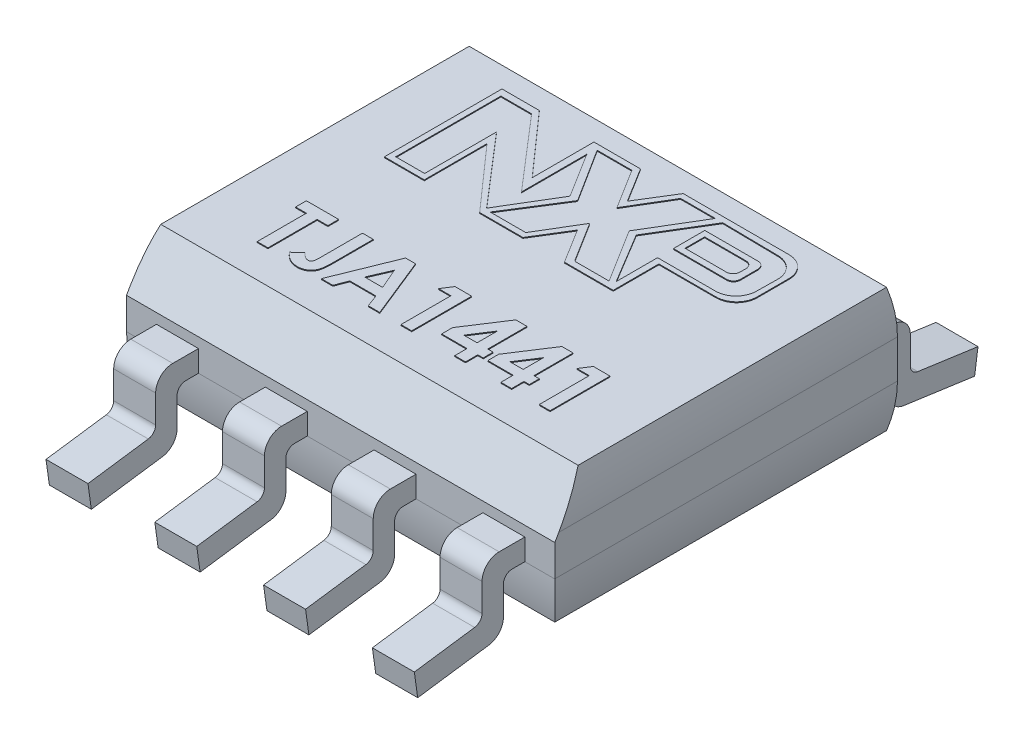
from build123d import *
from OCP.BRepAlgoAPI import BRepAlgoAPI_Cut
from OCP.TopTools import TopTools_ListOfShape

# Parameters (mm, degrees)
SKETCH1_W           = 5
SKETCH1_H           = 4
BOSS_EXTRUDE1_DEPTH = 1.45
CUT_EXTRUDE1_DEPTH  = 61.45
CUT_EXTRUDE2_DEPTH  = 61.45
BOSS_EXTRUDE2_DEPTH = 5
SKETCH7_W           = 0.35
SKETCH7_H           = 1.533953372
SKETCH7_W_2         = 0.78
SKETCH7_H_2         = 1.610570248
SKETCH7_H_3         = 1.782958217
SKETCH7_H_4         = 1.677610014
CUT_EXTRUDE3_DEPTH  = 61.45
BOSS_EXTRUDE3_DEPTH = 0.01
BOSS_EXTRUDE4_DEPTH = 0.01


with BuildPart() as part:
    # Sketch1 → Boss-Extrude1 (new body)
    with BuildSketch(Plane(origin=(0, 0, 0), x_dir=(1, 0, 0), z_dir=(0, 1, 0))):
        Rectangle(SKETCH1_W, SKETCH1_H)
    extrude(amount=BOSS_EXTRUDE1_DEPTH)

    # Sketch2 → Cut-Extrude1 (cut)
    with BuildSketch(Plane.ZY.offset(2.5)):
        Polygon((2, 0.86865368), (1.664359546, 1.45), (1.664359546, 1.731681291), (2.487143748, 1.731681291), (2.487143748, 0.86865368), align=None)
        with BuildLine():
            Line((-1.864420937, 1.672264495), (-2.155873567, 1.672264495))
            Line((-2.155873567, 1.672264495), (-2.155873567, 0.954004167))
            Line((-2.155873567, 0.954004167), (-1.999984404, 0.948389144))
            ThreePointArc((-1.999984404, 0.948389144), (-1.965805293, 1.316619369), (-1.864420937, 1.672264495))
        make_face()
        with BuildLine():
            Line((-1.999984404, 0.501610856), (-2.15587357, 0.501610856))
            Line((-2.15587357, 0.501610856), (-2.15587357, -0.22229559))
            Line((-2.15587357, -0.22229559), (-1.864420937, -0.222264495))
            ThreePointArc((-1.864420937, -0.222264495), (-1.965805293, 0.133380631), (-1.999984404, 0.501610856))
        make_face()
        with BuildLine():
            Line((2, 0.501548667), (2.487143748, 0.501548667))
            Line((2.487143748, 0.501548667), (2.487143748, -0.222291374))
            Line((2.487143748, -0.222291374), (1.864414025, -0.222322469))
            ThreePointArc((1.864414025, -0.222322469), (1.965809439, 0.133319505), (2, 0.501548667))
        make_face()
    extrude(amount=-CUT_EXTRUDE1_DEPTH, mode=Mode.SUBTRACT)


with BuildPart() as cut_extrude2_tool:
    # Sketch5 → Cut-Extrude2 (new body)
    with BuildSketch(Plane(origin=(0, 0, -2), x_dir=(-1, 0, 0), z_dir=(0, 0, -1))):
        with BuildLine():
            Line((-2.655873567, 0.954004878), (-2.499991937, 0.948390126))
            ThreePointArc((-2.499991937, 0.948390126), (-2.46581276, 1.316621068), (-2.364420937, 1.672264066))
            Line((-2.364420937, 1.672264066), (-2.655873567, 1.672264066))
            Line((-2.655873567, 1.672264066), (-2.655873567, 0.954004878))
        make_face()
        with BuildLine():
            ThreePointArc((-2.364420937, -0.222263785), (-2.46581276, 0.133379212), (-2.499991937, 0.501610155))
            Line((-2.499991937, 0.501610155), (-2.655873567, 0.495995403))
            Line((-2.65587357, 0.495995403), (-2.65587357, -0.22229488))
            Line((-2.65587357, -0.22229488), (-2.364420937, -0.222263785))
        make_face()
        with BuildLine():
            ThreePointArc((2.499991937, 0.948390126), (2.46581276, 1.316621068), (2.364420937, 1.672264066))
            Line((2.364420937, 1.672264066), (2.655873567, 1.672264066))
            Line((2.655873567, 1.672264066), (2.655873567, 0.954004878))
            Line((2.655873567, 0.954004878), (2.499991937, 0.948390126))
        make_face()
        with BuildLine():
            Line((2.499991937, 0.501610155), (2.65587357, 0.501610155))
            Line((2.65587357, 0.501610155), (2.65587357, -0.22229488))
            Line((2.65587357, -0.22229488), (2.364420937, -0.222263785))
            ThreePointArc((2.364420937, -0.222263785), (2.46581276, 0.133379212), (2.499991937, 0.501610155))
        make_face()
    extrude(amount=-CUT_EXTRUDE2_DEPTH)


with BuildPart() as part_1:
    add(part.part)

    # Cut-Extrude2: cut by cut_extrude2_tool, with a tolerance
    cut_extrude2_stock = TopTools_ListOfShape()
    cut_extrude2_stock.Append(part_1.part.wrapped)
    cut_extrude2_tools = TopTools_ListOfShape()
    cut_extrude2_tools.Append(cut_extrude2_tool.part.wrapped)
    cut_extrude2_cut = BRepAlgoAPI_Cut()
    cut_extrude2_cut.SetArguments(cut_extrude2_stock)
    cut_extrude2_cut.SetTools(cut_extrude2_tools)
    cut_extrude2_cut.SetFuzzyValue(0.00001)
    cut_extrude2_cut.Build()
    add(Compound.cast(cut_extrude2_cut.Shape()).solids(), mode=Mode.REPLACE)

    # Sketch6 → Boss-Extrude2 (add)
    with BuildSketch(Plane.ZY.offset(2.5)):
        with BuildLine():
            Line((2.300001958, 0.75), (2.253544498, 0.75))
            Line((2.253544498, 0.75), (-2.253544498, 0.75))
            Line((-2.253544498, 0.75), (-2.300001958, 0.75))
            ThreePointArc((-2.300001958, 0.75), (-2.441423314, 0.691421356), (-2.500001958, 0.55))
            Line((-2.500001958, 0.55), (-2.500001958, 0.227578594))
            ThreePointArc((-2.500001958, 0.227578594), (-2.524531, 0.161972691), (-2.586084648, 0.128551787))
            Line((-2.586084648, 0.128551787), (-3.290075098, 0.029612381))
            Line((-3.290075098, 0.029612381), (-3.250778141, -0.25))
            Line((-3.250778141, -0.25), (-2.422167338, -0.133546346))
            ThreePointArc((-2.422167338, -0.133546346), (-2.299060042, -0.066704538), (-2.250001958, 0.064507268))
            Line((-2.250001958, 0.064507268), (-2.250001958, 0.4))
            ThreePointArc((-2.250001958, 0.4), (-2.220712636, 0.470710678), (-2.150001958, 0.5))
            Line((-2.150001958, 0.5), (2.150001958, 0.5))
            ThreePointArc((2.150001958, 0.5), (2.220712636, 0.470710678), (2.250001958, 0.4))
            Line((2.250001958, 0.4), (2.250001958, 0.064507268))
            ThreePointArc((2.250001958, 0.064507268), (2.299060042, -0.066704538), (2.422167338, -0.133546346))
            Line((2.422167338, -0.133546346), (3.250778141, -0.25))
            Line((3.250778141, -0.25), (3.290075098, 0.029612381))
            Line((3.290075098, 0.029612381), (2.586084648, 0.128551787))
            ThreePointArc((2.586084648, 0.128551787), (2.524531, 0.161972691), (2.500001958, 0.227578594))
            Line((2.500001958, 0.227578594), (2.500001958, 0.55))
            ThreePointArc((2.500001958, 0.55), (2.441423314, 0.691421356), (2.300001958, 0.75))
        make_face()
    extrude(amount=-BOSS_EXTRUDE2_DEPTH)

    # Sketch7 → Cut-Extrude3 (cut)
    with BuildSketch(Plane(origin=(0, 1.45, 0), x_dir=(1, 0, 0), z_dir=(0, 1, 0))):
        with Locations((-2.325, -2.766976686)):
            Rectangle(SKETCH7_W, SKETCH7_H)
        with Locations((-1.27, -2.805285124)):
            Rectangle(SKETCH7_W_2, SKETCH7_H_2)
        with Locations((0, -2.805285124)):
            Rectangle(SKETCH7_W_2, SKETCH7_H_2)
        with Locations((2.325, -2.891479109)):
            Rectangle(SKETCH7_W, SKETCH7_H_3)
        with Locations((1.27, -2.838805007)):
            Rectangle(SKETCH7_W_2, SKETCH7_H_4)
        with Locations((1.27, 2.838805007)):
            Rectangle(SKETCH7_W_2, SKETCH7_H_4)
        with Locations((2.325, 2.891479109)):
            Rectangle(SKETCH7_W, SKETCH7_H_3)
        with Locations((0, 2.805285124)):
            Rectangle(SKETCH7_W_2, SKETCH7_H_2)
        with Locations((-1.27, 2.805285124)):
            Rectangle(SKETCH7_W_2, SKETCH7_H_2)
        with Locations((-2.325, 2.766976686)):
            Rectangle(SKETCH7_W, SKETCH7_H)
    extrude(amount=-CUT_EXTRUDE3_DEPTH, mode=Mode.SUBTRACT)

    # Sketch8 → Boss-Extrude3 (add)
    # profile 1 of 2: a face of its own
    with BuildSketch(Plane(origin=(0, 1.45, 0), x_dir=(1, 0, 0), z_dir=(0, 1, 0))):
        with BuildLine():
            Line((-1.803375496, 0.313929244), (-1.803375496, 1.686128651))
            Line((-1.803375496, 1.686128651), (-1.367177563, 1.686128651))
            Line((-1.367177563, 1.686128651), (-0.729512855, 0.965015135))
            Line((-0.729512855, 0.965015135), (-0.729512855, 1.686128651))
            Line((-0.729512855, 1.686128651), (-0.186049825, 1.686128651))
            Line((-0.186049825, 1.686128651), (0.063647762, 1.28357467))
            Line((0.063647762, 1.28357467), (0.31227987, 1.686128651))
            Line((0.31227987, 1.686128651), (1.548664193, 1.686128651))
            ThreePointArc((1.548664193, 1.686128651), (1.71836982, 1.615834278), (1.788664193, 1.446128651))
            Line((1.788664193, 1.446128651), (1.788664193, 1.073244082))
            ThreePointArc((1.788664193, 1.073244082), (1.71836982, 0.903538454), (1.548664193, 0.833244082))
            Line((1.548664193, 0.833244082), (0.881704624, 0.833244082))
            Line((0.881704624, 0.833244082), (0.881704624, 0.299873291))
            Line((0.881704624, 0.299873291), (0.31227987, 0.299873291))
            Line((0.31227987, 0.299873291), (0.063647762, 0.700709541))
            Line((0.063647762, 0.700709541), (-0.179553334, 0.306948774))
            Line((-0.179553334, 0.306948774), (-0.684190472, 0.306948774))
            Line((-0.684190472, 0.306948774), (-1.337736001, 1.046021375))
            Line((-1.337736001, 1.046021375), (-1.337736001, 0.313929244))
            Line((-1.337736001, 0.313929244), (-1.803375496, 0.313929244))
        make_face()
        Polygon((-1.737717167, 0.380080618), (-1.737717167, 1.607932124), (-1.378914568, 1.607932124), (-0.648130736, 0.758975413), (-0.648130736, 1.522116291), (-0.322062078, 0.999645994), (-0.687545107, 0.391434051), (-1.399882226, 1.218961086), (-1.399882226, 0.380080618), align=None, mode=Mode.SUBTRACT)
        Polygon((-0.627925102, 1.622168194), (-0.22215297, 1.622168194), (0.06797424, 1.157765207), (0.346386813, 1.622168194), (0.751426259, 1.622168194), (0.374330406, 0.993157662), (0.764288881, 0.368956019), (0.361905461, 0.368956019), (0.06797424, 0.839448039), (-0.211673984, 0.372983937), (-0.627925102, 0.372983937), (-0.233354138, 0.999645994), align=None, mode=Mode.SUBTRACT)
        with BuildLine():
            Line((0.838091157, 1.622168194), (1.493858319, 1.612977237))
            ThreePointArc((1.493858319, 1.612977237), (1.662562161, 1.540311479), (1.730471342, 1.369637398))
            Line((1.730471342, 1.369637398), (1.727040318, 1.124836692))
            ThreePointArc((1.727040318, 1.124836692), (1.655576174, 0.957309466), (1.487063887, 0.888200101))
            Line((1.487063887, 0.888200101), (0.811207804, 0.888200101))
            Line((0.811207804, 0.888200101), (0.811207804, 0.405870091))
            Line((0.811207804, 0.405870091), (0.45710645, 0.993157662))
            Line((0.45710645, 0.993157662), (0.838091157, 1.622168194))
        make_face(mode=Mode.SUBTRACT)
    # profile 2 of 2: a face of its own
    with BuildSketch(Plane(origin=(0, 1.45, 0), x_dir=(1, 0, 0), z_dir=(0, 1, 0))):
        with BuildLine():
            Line((0.811207804, 1.439616889), (1.43299067, 1.439616889))
            ThreePointArc((1.43299067, 1.439616889), (1.489559213, 1.416185432), (1.51299067, 1.359616889))
            Line((1.51299067, 1.359616889), (1.51299067, 1.153244082))
            ThreePointArc((1.51299067, 1.153244082), (1.489559213, 1.096675539), (1.43299067, 1.073244082))
            Line((1.43299067, 1.073244082), (0.811207804, 1.073244082))
            Line((0.811207804, 1.073244082), (0.811207804, 1.439616889))
        make_face()
        with BuildLine():
            Line((0.875476734, 1.373219945), (1.358258838, 1.373219945))
            ThreePointArc((1.358258838, 1.373219945), (1.41482738, 1.349788487), (1.438258838, 1.293219945))
            Line((1.438258838, 1.293219945), (1.438258838, 1.223991427))
            ThreePointArc((1.438258838, 1.223991427), (1.41482738, 1.167422884), (1.358258838, 1.143991427))
            Line((1.358258838, 1.143991427), (0.875476734, 1.143991427))
            Line((0.875476734, 1.143991427), (0.875476734, 1.373219945))
        make_face(mode=Mode.SUBTRACT)
    extrude(amount=BOSS_EXTRUDE3_DEPTH)

    # Sketch9 → Boss-Extrude4 (add)
    # profile 1 of 7: a face of its own
    with BuildSketch(Plane(origin=(0, 1.45, 0), x_dir=(1, 0, 0), z_dir=(0, 1, 0))):
        Polygon((-1.81434085, -0.586083303), (-1.437417773, -0.586083303), (-1.437417773, -0.711724328), (-1.563058799, -0.711724328), (-1.563058799, -1.286083303), (-1.688699825, -1.286083303), (-1.688699825, -0.711724328), (-1.81434085, -0.711724328), align=None)
    # profile 2 of 7: a face of its own
    with BuildSketch(Plane(origin=(0, 1.45, 0), x_dir=(1, 0, 0), z_dir=(0, 1, 0))):
        with BuildLine():
            Line((-1.159212645, -0.586083303), (-1.03357162, -0.586083303))
            Line((-1.03357162, -0.586083303), (-1.03357162, -1.050786828))
            add(Edge.make_bspline(
                [(-1.03357162, -1.050786828), (-1.033617683, -1.059668569), (-1.033706439, -1.076781931), (-1.034595042, -1.101418854), (-1.03579659, -1.124007236), (-1.037526935, -1.144510882), (-1.040096971, -1.162928802), (-1.043005471, -1.179306946), (-1.046214354, -1.19371205), (-1.051634945, -1.209833603), (-1.060050255, -1.227686389), (-1.072749198, -1.246969934), (-1.088563447, -1.26372405), (-1.106776238, -1.278276935), (-1.127541028, -1.289800068), (-1.150379444, -1.298129019), (-1.175218477, -1.303104792), (-1.192422632, -1.30371689), (-1.201279953, -1.304032021)],
                knots=[0, 0, 0, 0, 1.22248561, 2.355488409, 3.392943897, 4.335991845, 5.186735882, 5.951517034, 6.625683685, 7.215700098, 8.28923535, 9.333114649, 10.380102123, 11.447198135, 12.530158036, 13.633358744, 14.781567393, 16, 16, 16, 16], degree=3))
            add(Edge.make_bspline(
                [(-1.201279953, -1.304032021), (-1.210508476, -1.303746316), (-1.228710727, -1.303182795), (-1.255406203, -1.298383046), (-1.281063892, -1.290687603), (-1.305551055, -1.279560916), (-1.329203174, -1.265623237), (-1.351590985, -1.248334903), (-1.373181914, -1.228232102), (-1.385981148, -1.212805716), (-1.392545979, -1.204893399)],
                knots=[0, 0, 0, 0, 0.990984786, 1.954608977, 2.90473533, 3.862451285, 4.837525908, 5.848096122, 6.896271184, 8, 8, 8, 8], degree=3))
            Line((-1.392545979, -1.204893399), (-1.297473863, -1.116972726))
            add(Edge.make_bspline(
                [(-1.297473863, -1.116972726), (-1.292495995, -1.122601289), (-1.283181064, -1.133133845), (-1.269143738, -1.146868557), (-1.256481314, -1.157902812), (-1.24454484, -1.16586192), (-1.233280675, -1.171472202), (-1.222446464, -1.175513446), (-1.211704488, -1.17780102), (-1.204608011, -1.178197313), (-1.201139729, -1.178390995)],
                knots=[0, 0, 0, 0, 1.529509877, 2.862124173, 3.996688592, 4.944357383, 5.774364335, 6.554177287, 7.293378699, 8, 8, 8, 8], degree=3))
            add(Edge.make_bspline(
                [(-1.201139729, -1.178390995), (-1.197782817, -1.178215937), (-1.19132858, -1.177879359), (-1.182453757, -1.174137867), (-1.174971709, -1.168263568), (-1.170045971, -1.161510298), (-1.166906972, -1.154606639), (-1.164945666, -1.14793319), (-1.163084384, -1.139933535), (-1.161593166, -1.130611681), (-1.160466399, -1.119846038), (-1.159904787, -1.1077673), (-1.159221795, -1.094310196), (-1.159215804, -1.084909241), (-1.159212645, -1.079953495)],
                knots=[0, 0, 0, 0, 1.003927327, 1.930222208, 2.840933547, 3.835773585, 4.407906147, 5.114514582, 5.922289074, 6.876303333, 7.950072246, 9.174518422, 10.510537432, 12, 12, 12, 12], degree=3))
            Line((-1.159212645, -1.079953495), (-1.159212645, -0.586083303))
        make_face()
    # profile 3 of 7: a face of its own
    with BuildSketch(Plane(origin=(0, 1.45, 0), x_dir=(1, 0, 0), z_dir=(0, 1, 0))):
        Polygon((-0.656508318, -0.586083303), (-0.539981876, -0.586083303), (-0.257289568, -1.286083303), (-0.39148428, -1.286083303), (-0.445891331, -1.142493559), (-0.750879312, -1.142493559), (-0.805286363, -1.286083303), (-0.93934085, -1.286083303), align=None)
        Polygon((-0.598315209, -0.773843719), (-0.70320303, -1.016852533), (-0.493427389, -1.016852533), align=None, mode=Mode.SUBTRACT)
    # profile 4 of 7: a face of its own
    with BuildSketch(Plane(origin=(0, 1.45, 0), x_dir=(1, 0, 0), z_dir=(0, 1, 0))):
        Polygon((-0.079064408, -0.586083303), (0.115146329, -0.586083303), (0.115146329, -1.286083303), (-0.010494697, -1.286083303), (-0.010494697, -0.702749969), (-0.15408444, -0.702749969), align=None)
    # profile 5 of 7: a face of its own
    with BuildSketch(Plane(origin=(0, 1.45, 0), x_dir=(1, 0, 0), z_dir=(0, 1, 0))):
        Polygon((0.612381906, -0.568134585), (0.743351457, -0.568134585), (0.743351457, -1.025826892), (0.80617197, -1.025826892), (0.80617197, -1.142493559), (0.743351457, -1.142493559), (0.743351457, -1.286083303), (0.617710432, -1.286083303), (0.617710432, -1.142493559), (0.321556585, -1.142493559), (0.321556585, -1.015310065), align=None)
        Polygon((0.617710432, -1.025826892), (0.617710432, -0.787585706), (0.462762515, -1.025826892), align=None, mode=Mode.SUBTRACT)
    # profile 6 of 7: a face of its own
    with BuildSketch(Plane(origin=(0, 1.45, 0), x_dir=(1, 0, 0), z_dir=(0, 1, 0))):
        Polygon((1.150843444, -0.568134585), (1.281812996, -0.568134585), (1.281812996, -1.025826892), (1.344633509, -1.025826892), (1.344633509, -1.142493559), (1.281812996, -1.142493559), (1.281812996, -1.286083303), (1.15617197, -1.286083303), (1.15617197, -1.142493559), (0.860018124, -1.142493559), (0.860018124, -1.015310065), align=None)
        Polygon((1.15617197, -1.025826892), (1.15617197, -0.787585706), (1.001224053, -1.025826892), align=None, mode=Mode.SUBTRACT)
    # profile 7 of 7: a face of its own
    with BuildSketch(Plane(origin=(0, 1.45, 0), x_dir=(1, 0, 0), z_dir=(0, 1, 0))):
        Polygon((1.536320207, -0.586083303), (1.730530944, -0.586083303), (1.730530944, -1.286083303), (1.604889919, -1.286083303), (1.604889919, -0.702749969), (1.461300175, -0.702749969), align=None)
    extrude(amount=BOSS_EXTRUDE4_DEPTH)


solid = part_1.part
